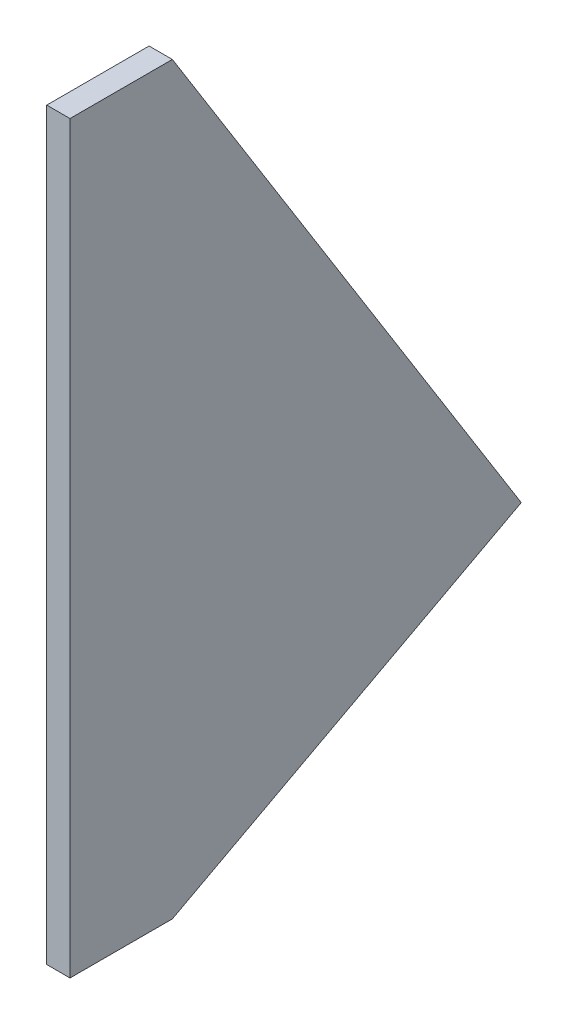
from build123d import *

# Parameters (mm, degrees)
BOSS_EXTRUDE1_DEPTH = 3.175


with BuildPart() as part:
    # Sketch1 → Boss-Extrude1 (new, symmetric)
    with BuildSketch(Plane(origin=(0, 0, 0), x_dir=(0, 0, -1), z_dir=(1, 0, 0))):
        Polygon((0, 0), (0, 203.2), (27.94, 203.2), (123.19, 50.8), (27.94, 0), align=None)
    extrude(amount=BOSS_EXTRUDE1_DEPTH, both=True)


solid = part.part
